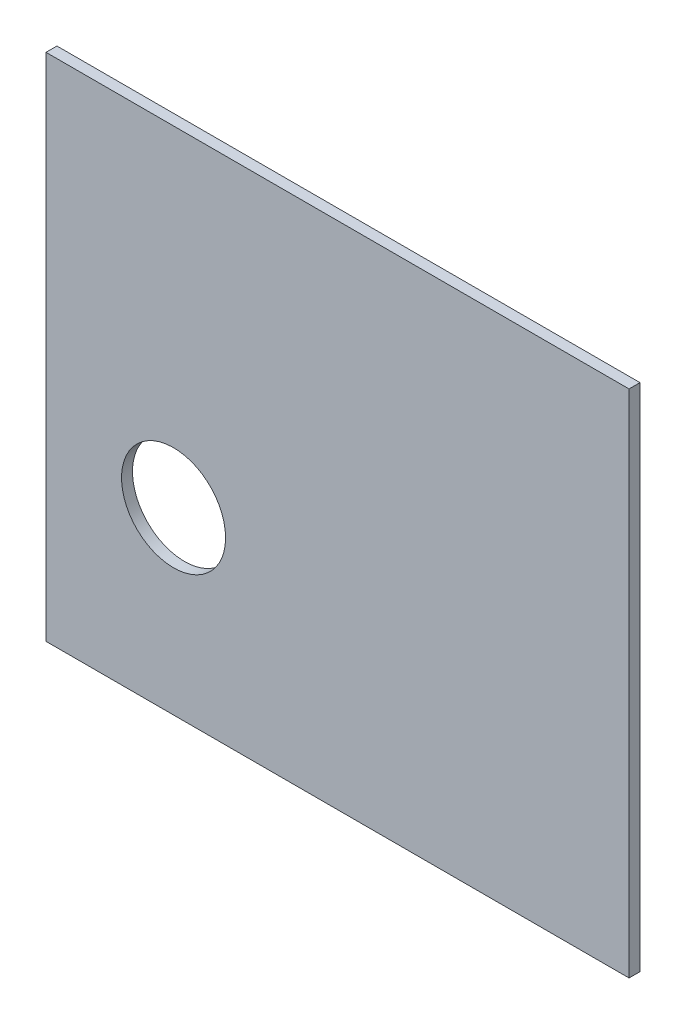
from build123d import *

# Parameters (mm, degrees)
SKETCH1_W           = 160
SKETCH1_H           = 140
BOSS_EXTRUDE1_DEPTH = 3
SKETCH2_R           = 14.275
CUT_EXTRUDE1_DEPTH  = 3


with BuildPart() as part:
    # Sketch1 → Boss-Extrude1 (new body)
    with BuildSketch(Plane.XY):
        with Locations((80, 70)):
            Rectangle(SKETCH1_W, SKETCH1_H)
    extrude(amount=BOSS_EXTRUDE1_DEPTH)

    # Sketch2 → Cut-Extrude1 (cut)
    with BuildSketch(Plane.XY.offset(3)):
        with Locations((35, 49.26)):
            Circle(SKETCH2_R)
    extrude(amount=-CUT_EXTRUDE1_DEPTH, mode=Mode.SUBTRACT)


solid = part.part
